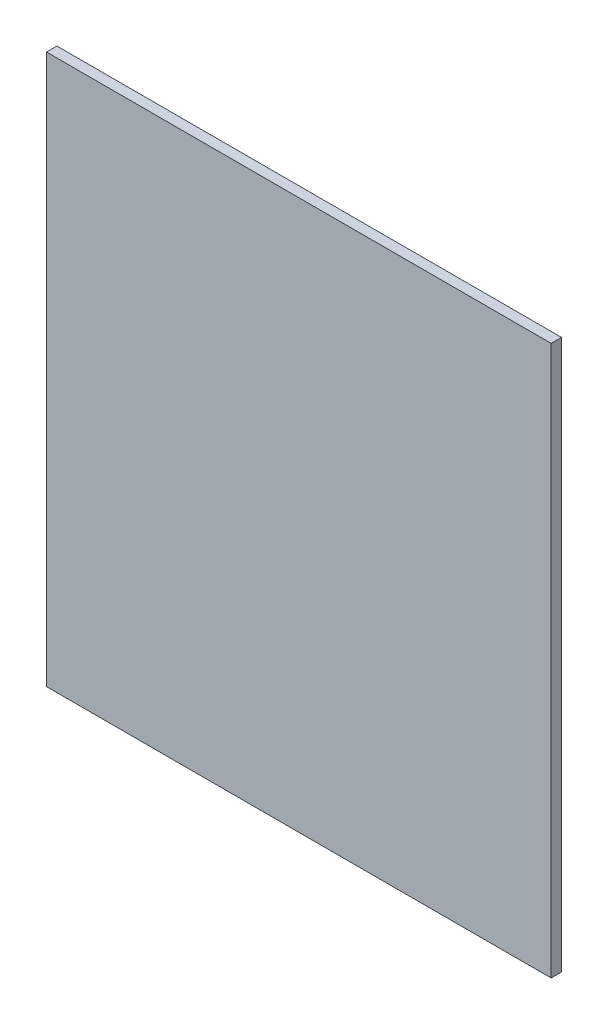
from build123d import *

# Parameters (mm, degrees)
SKETCH_1_W      = 292
SKETCH_1_H      = 318
EXTRUDE_1_DEPTH = 6


with BuildPart() as part:
    # Эскиз1 → Бобышка-Вытянуть1 (new body)
    with BuildSketch(Plane.XY):
        with Locations((146, -159)):
            Rectangle(SKETCH_1_W, SKETCH_1_H)
    extrude(amount=EXTRUDE_1_DEPTH)


solid = part.part
